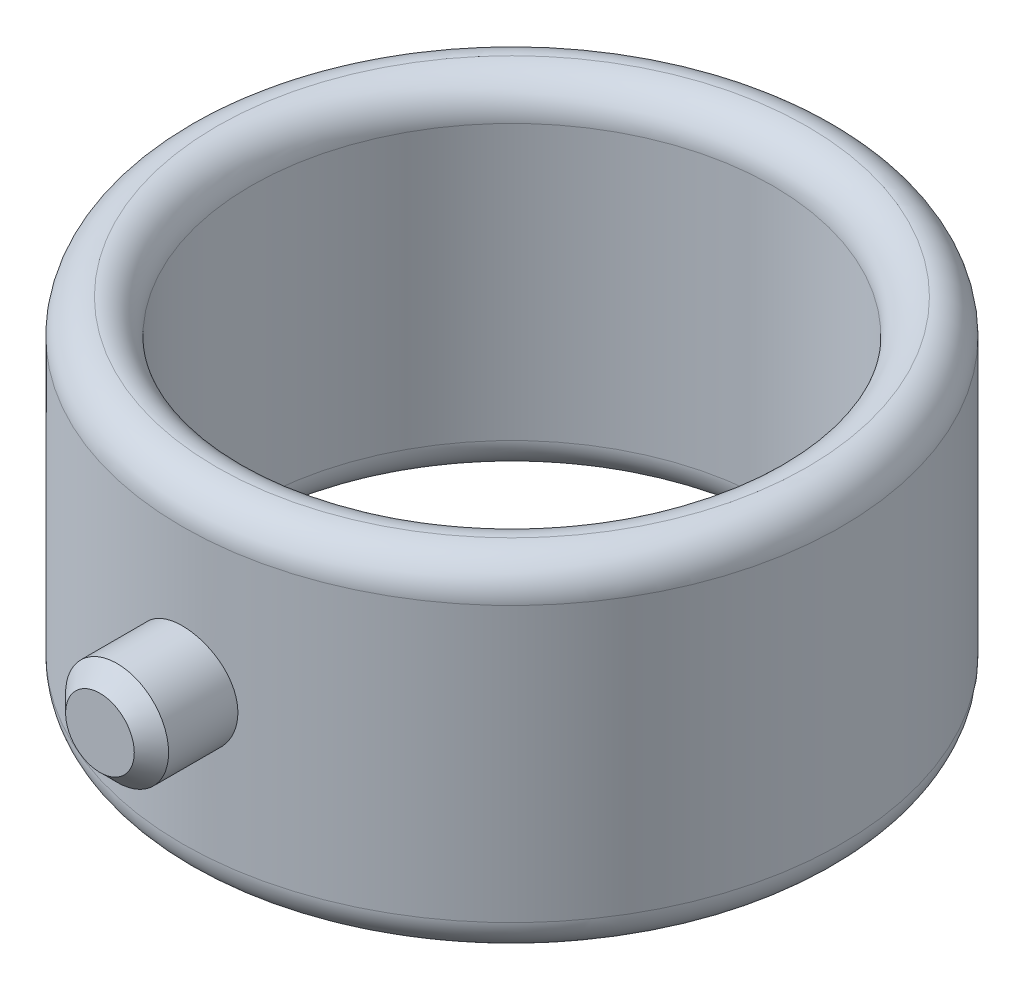
from build123d import *

# Parameters (mm, degrees)
SKETCH1_R                = 9.6
BOSS_EXTRUDE1_DEPTH      = 10
BOSS_EXTRUDE2_DEPTH      = 12
BOSS_EXTRUDE2_DEPTH_BACK = 12
SKETCH2_R                = 1.5
SKETCH3_R                = 7.6
CUT_EXTRUDE1_DEPTH       = 12
FILLET1_R                = 1
CHAMFER1_SIZE            = 0.5


with BuildPart() as part:
    # Sketch1 → Boss-Extrude1 (new body)
    with BuildSketch(Plane(origin=(0, 0, 0), x_dir=(1, 0, 0), z_dir=(0, 1, 0))):
        with Locations(Location((0, 0, 0), (0, 0, 270))):
            Circle(SKETCH1_R)
    extrude(amount=BOSS_EXTRUDE1_DEPTH)

    # Sketch2 → Boss-Extrude2 (add, two sides: drawn at the far end of the back side and taken through both)
    with BuildSketch(Plane.XY.offset(-BOSS_EXTRUDE2_DEPTH_BACK)):
        with Locations((0, 5)):
            Circle(SKETCH2_R)
    extrude(amount=BOSS_EXTRUDE2_DEPTH + BOSS_EXTRUDE2_DEPTH_BACK)

    # Sketch3 → Cut-Extrude1 (cut)
    with BuildSketch(Plane(origin=(0, 10, 0), x_dir=(1, 0, 0), z_dir=(0, 1, 0))):
        with Locations(Location((0, 0, 0), (0, 0, 270))):
            Circle(SKETCH3_R)
    extrude(amount=-CUT_EXTRUDE1_DEPTH, mode=Mode.SUBTRACT)

    # Fillet1
    fillet1_edges = [part.edges().sort_by_distance(p)[0] for p in [
        (0, 0, -7.6),
        (0, 10, -7.6),
        (0, 0, -9.6),
        (0, 10, -9.6),
    ]]
    fillet(fillet1_edges, radius=FILLET1_R - 0.0001)  # a hair under: the kernel refuses the full size

    # Chamfer1
    chamfer1_edges = [part.edges().sort_by_distance(p)[0] for p in [
        (-1.5, 5, -12),
        (-1.5, 5, 12),
    ]]
    chamfer(chamfer1_edges, length=CHAMFER1_SIZE)


solid = part.part
